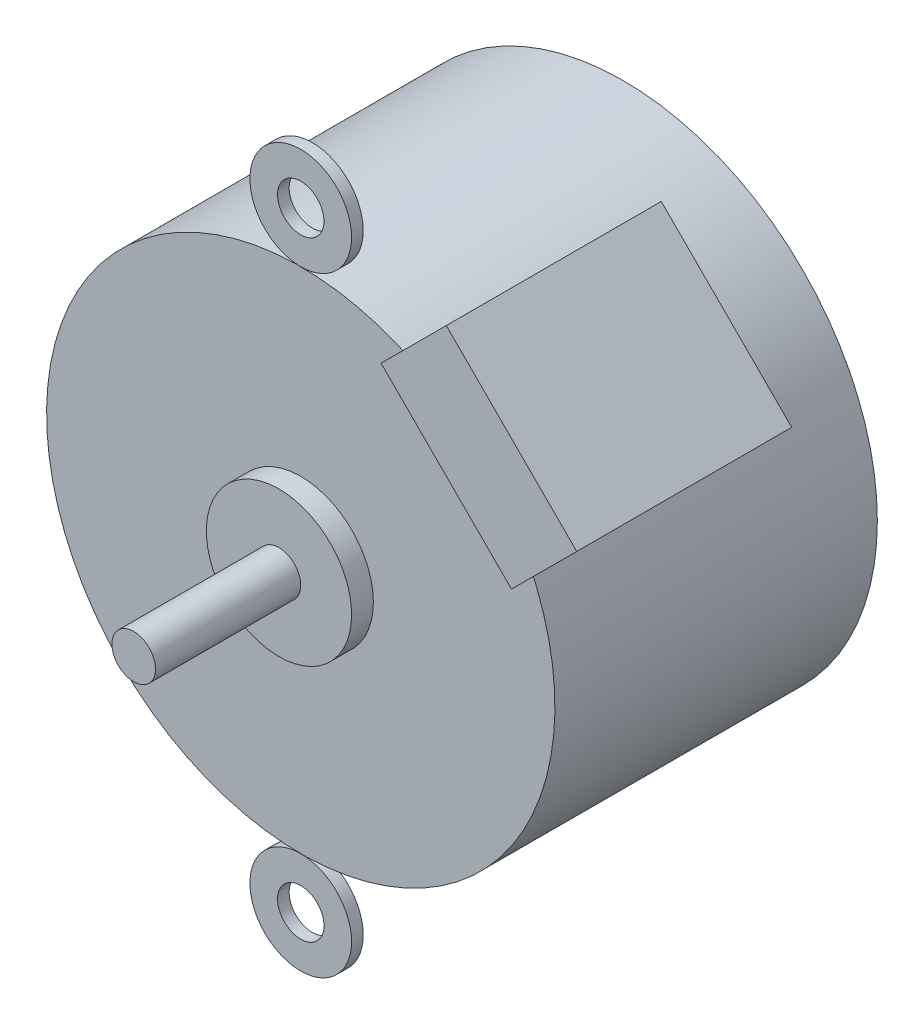
from build123d import *

# Parameters (mm, degrees)
SKETCH1_R           = 17.5
BOSS_EXTRUDE1_DEPTH = 0.8
SKETCH2_R           = 3.5
BOSS_EXTRUDE2_DEPTH = 0.8
SKETCH3_R           = 3.5
BOSS_EXTRUDE3_DEPTH = 0.8
SKETCH4_R           = 1.6
CUT_EXTRUDE4_DEPTH  = 1.8
BOSS_EXTRUDE4_START = -21.4
SKETCH5_R           = 17.5
BOSS_EXTRUDE4_DEPTH = 21.4
SKETCH6_R           = 4
BOSS_EXTRUDE5_DEPTH = 22.4
SKETCH7_R           = 5
BOSS_EXTRUDE6_DEPTH = 2.3
SKETCH8_R           = 1.5
BOSS_EXTRUDE7_DEPTH = 12.3
BOSS_EXTRUDE8_DEPTH = 12
BOSS_EXTRUDE9_DEPTH = 2.8


with BuildPart() as part:
    # Sketch1 → Boss-Extrude1 (new body)
    with BuildSketch(Plane.XY):
        Circle(SKETCH1_R)
    extrude(amount=BOSS_EXTRUDE1_DEPTH)

    # Sketch5 → Boss-Extrude4 (add)
    with BuildSketch(Plane.XY.offset(BOSS_EXTRUDE4_START)):
        Circle(SKETCH5_R)
    extrude(amount=BOSS_EXTRUDE4_DEPTH)

    # Sketch6 → Boss-Extrude5 (add)
    with BuildSketch(Plane.XY):
        Circle(SKETCH6_R)
    extrude(amount=-BOSS_EXTRUDE5_DEPTH)

    # Sketch7 → Boss-Extrude6 (add)
    with BuildSketch(Plane.XY):
        Circle(SKETCH7_R)
    extrude(amount=BOSS_EXTRUDE6_DEPTH)

    # Sketch8 → Boss-Extrude7 (add)
    with BuildSketch(Plane.XY):
        Circle(SKETCH8_R)
    extrude(amount=BOSS_EXTRUDE7_DEPTH)

    # Sketch9 → Boss-Extrude8 (add)
    with BuildSketch(Plane.XY):
        Polygon((16.510943341, 7.53068722), (7.53068722, 16.510943341), (12.02081528, 21.001071401), (21.001071401, 12.02081528), align=None)
    extrude(amount=-BOSS_EXTRUDE8_DEPTH)

    # Sketch10 → Boss-Extrude9 (add)
    with BuildSketch(Plane.XY):
        Polygon((16.510943341, 7.53068722), (7.53068722, 16.510943341), (12.02081528, 21.001071401), (21.001071401, 12.02081528), align=None)
    extrude(amount=BOSS_EXTRUDE9_DEPTH)


with BuildPart() as body_2:
    # Sketch2 → Boss-Extrude2 (new body)
    with BuildSketch(Plane.XY):
        with Locations((0, 21)):
            Circle(SKETCH2_R)
    extrude(amount=BOSS_EXTRUDE2_DEPTH)


with BuildPart() as body_3:
    # Sketch3 → Boss-Extrude3 (new body)
    with BuildSketch(Plane.XY):
        with Locations((0, -21)):
            Circle(SKETCH3_R)
    extrude(amount=BOSS_EXTRUDE3_DEPTH)


with BuildPart() as cut_extrude4_tool:
    # Sketch4 → Cut-Extrude4 (new body)
    with BuildSketch(Plane.XY):
        with Locations((0, 21)):
            Circle(SKETCH4_R)
        with Locations((0, -21)):
            Circle(SKETCH4_R)
    extrude(amount=CUT_EXTRUDE4_DEPTH)


with BuildPart() as body_2_1:
    add(body_2.part)

    # Cut-Extrude4: cut by cut_extrude4_tool
    add(cut_extrude4_tool.part, mode=Mode.SUBTRACT)


with BuildPart() as body_3_1:
    add(body_3.part)

    # Cut-Extrude4: cut by cut_extrude4_tool
    add(cut_extrude4_tool.part, mode=Mode.SUBTRACT)


solid = Compound([part.part, body_2_1.part, body_3_1.part])
